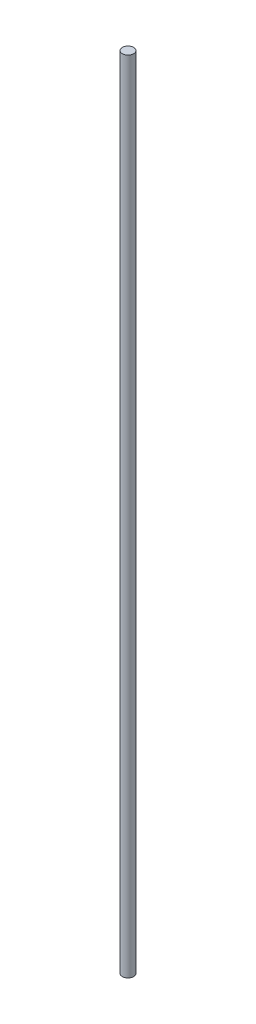
from build123d import *

# Parameters (mm, degrees)
SKETCH1_R           = 1.4224
BOSS_EXTRUDE1_DEPTH = 203.2


with BuildPart() as part:
    # Sketch1 → Boss-Extrude1 (new body)
    with BuildSketch(Plane(origin=(0, 0, 0), x_dir=(1, 0, 0), z_dir=(0, 1, 0))):
        Circle(SKETCH1_R)
    extrude(amount=BOSS_EXTRUDE1_DEPTH)


solid = part.part
